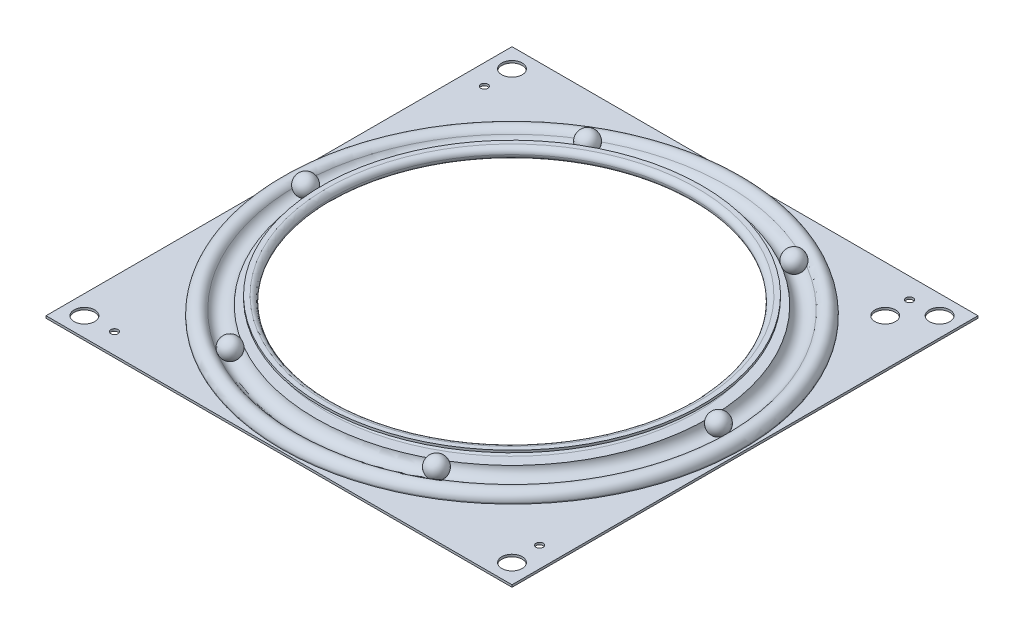
from build123d import *

# Parameters (mm, degrees)
SKETCH2_W                                 = 154.0002
SKETCH2_H                                 = 154.0002
SKETCH2_R                                 = 75.529340861
EXTRUDE1_DEPTH                            = 0.7366
EXTRUDE2_START                            = -0.7366
SKETCH3_R                                 = 75.529340861
EXTRUDE2_DEPTH                            = 0.7366
CIRPATTERN1_COUNT                         = 6
SKETCH5_W                                 = 3.3782
SKETCH5_H                                 = 0.7366
F_5_32_0_156250_DIAMETER_HOLE1_AT_2_COUNT = 2
F_5_32_0_156250_DIAMETER_HOLE1_AT_2_PITCH = 141.3002
F_5_32_0_156250_DIAMETER_HOLE1_AT_3_COUNT = 2
F_5_32_0_156250_DIAMETER_HOLE1_AT_3_PITCH = 141.3002
F_5_32_0_156250_DIAMETER_HOLE1_AT_4_COUNT = 2
F_5_32_0_156250_DIAMETER_HOLE1_AT_4_PITCH = 199.828659206
SKETCH7_W                                 = 2.3876
SKETCH7_H                                 = 8.128
F_5_32_0_156250_DIAMETER_HOLE2_AT_2_COUNT = 2
F_5_32_0_156250_DIAMETER_HOLE2_AT_2_PITCH = 121.0564
F_5_32_0_156250_DIAMETER_HOLE2_AT_3_COUNT = 2
F_5_32_0_156250_DIAMETER_HOLE2_AT_3_PITCH = 171.199602692
F_5_32_0_156250_DIAMETER_HOLE2_AT_4_COUNT = 2
F_5_32_0_156250_DIAMETER_HOLE2_AT_4_PITCH = 121.0564
CIRPATTERN2_COUNT                         = 4
SKETCH14_R                                = 3.3782
CUT_EXTRUDE2_DEPTH                        = 110.094654388


# Read off the part's stored shape, not the designer's step: Revolve-Thin5
with BuildPart() as part:
    # Sketch1 → Revolve-Thin4 (revolve)
    with BuildSketch(Plane.XY, mode=Mode.PRIVATE) as revolve_thin4_sk:
        with BuildLine():
            Line((62.74854946, 1.778), (61.214, 1.778))
            ThreePointArc((61.214, 1.778), (59.436, 0), (61.214, -1.778))
            Line((61.214, -1.778), (64.28309892, -1.778))
            ThreePointArc((64.28309892, -1.778), (67.669225582, -4.788771381), (71.737577241, -2.794))
            ThreePointArc((71.737577241, -2.794), (74.023261161, -1.847238721), (75.529340861, -3.81))
            Line((75.529340861, -3.81), (75.529340861, -4.826))
            Line((75.529340861, -4.826), (77.0001, -4.826))
            Line((77.0001, -4.826), (77.0001, -4.0894))
            Line((77.0001, -4.0894), (76.265940861, -4.0894))
            Line((76.265940861, -4.0894), (76.265940861, -3.81))
            ThreePointArc((76.265940861, -3.81), (74.21390727, -1.135737757), (71.099662929, -2.4257))
            ThreePointArc((71.099662929, -2.4257), (67.492675346, -4.00937161), (64.902401285, -1.0414))
            Line((64.902401285, -1.0414), (61.214, -1.0414))
            ThreePointArc((61.214, -1.0414), (60.1726, 0), (61.214, 1.0414))
            Line((61.214, 1.0414), (62.74854946, 1.0414))
            Line((62.74854946, 1.0414), (62.74854946, 1.778))
        make_face()
    revolve(revolve_thin4_sk.sketch.rotate(Axis((0, 21.71272626, 0), (0, -1, 0)), 90), axis=Axis((0, 21.71272626, 0), (0, -1, 0)))

    # Sketch2 → Extrude1 (add)
    with BuildSketch(Plane.XZ.offset(4.826)):
        Rectangle(SKETCH2_W, SKETCH2_H)
        with Locations(Location((0, 0, 0), (0, 0, 90))):
            Circle(SKETCH2_R, mode=Mode.SUBTRACT)
    extrude(amount=-EXTRUDE1_DEPTH)

    # Sketch5 → 5/32 (0.156250) Diameter Hole1 (revolve, cut)
    with BuildSketch(Plane(origin=(70.6501, -4.0894, -70.6501), x_dir=(0, 0, 1), z_dir=(1, 0, 0))):
        with Locations((1.6891, 0.3683)):
            Rectangle(SKETCH5_W, SKETCH5_H)
    f_5_32_0_156250_diameter_hole1 = revolve(axis=Axis((70.6501, 2.2606, -70.6501), (0, -1, 0)), mode=Mode.SUBTRACT)

    # 5/32 (0.156250) Diameter Hole1 at 2: 5/32 (0.156250) Diameter Hole1 ×2
    with Locations(*[(0, 0, i * F_5_32_0_156250_DIAMETER_HOLE1_AT_2_PITCH) for i in range(1, F_5_32_0_156250_DIAMETER_HOLE1_AT_2_COUNT)]):
        add(f_5_32_0_156250_diameter_hole1, mode=Mode.SUBTRACT)

    # 5/32 (0.156250) Diameter Hole1 at 3: 5/32 (0.156250) Diameter Hole1 ×2
    with Locations(*[(-i * F_5_32_0_156250_DIAMETER_HOLE1_AT_3_PITCH, 0, 0) for i in range(1, F_5_32_0_156250_DIAMETER_HOLE1_AT_3_COUNT)]):
        add(f_5_32_0_156250_diameter_hole1, mode=Mode.SUBTRACT)

    # 5/32 (0.156250) Diameter Hole1 at 4: 5/32 (0.156250) Diameter Hole1 ×2
    with Locations(*[Vector(-0.7071067811865476, 0, 0.7071067811865476) * (i * F_5_32_0_156250_DIAMETER_HOLE1_AT_4_PITCH) for i in range(1, F_5_32_0_156250_DIAMETER_HOLE1_AT_4_COUNT)]):
        add(f_5_32_0_156250_diameter_hole1, mode=Mode.SUBTRACT)

    # Sketch11 → 3/32 (0.093750) Diameter Hole2 (revolve, cut)
    with BuildSketch(Plane(origin=(-70.2437, -4.0894, -61.1251), x_dir=(0, 0, 1), z_dir=(1, 0, 0))):
        Polygon((0, 0), (0, 26.115399675), (1.190625, 25.4), (1.190625, 0), align=None)
    f_3_32_0_093750_diameter_hole2 = revolve(axis=Axis((-70.2437, 2.2606, -61.1251), (0, -1, 0)), mode=Mode.SUBTRACT)

    # CirPattern2: 3/32 (0.093750) Diameter Hole2 ×4 about axis
    cirpattern2_axis = Axis((0, 0, 0), (0, 1, 0))
    for i in range(1, CIRPATTERN2_COUNT):
        add(f_3_32_0_093750_diameter_hole2.rotate(cirpattern2_axis, i * 360 / CIRPATTERN2_COUNT), mode=Mode.SUBTRACT)

    # Sketch14 → Cut-Extrude2 (cut, through all)
    with BuildSketch(Plane(origin=(0, -4.0894, 0), x_dir=(1, 0, 0), z_dir=(0, 1, 0))):
        with Locations(Location((61.669843879, 61.669843879, 0), (0, 0, 270))):
            Circle(SKETCH14_R)
    extrude(amount=-CUT_EXTRUDE2_DEPTH, mode=Mode.SUBTRACT)


with BuildPart() as body_2:
    # Revolve-Thin5 outline → Revolve-Thin5 (revolve)
    with BuildSketch(Plane.XY):
        with BuildLine():
            Line((76.265940861, 2.5654), (77.0001, 2.5654))
            Line((77.0001, 2.5654), (77.0001, 3.302))
            Line((77.0001, 3.302), (75.529340861, 3.302))
            Line((75.529340861, 3.302), (75.529340861, 2.286))
            ThreePointArc((75.529340861, 2.286), (74.023261161, 0.323238721), (71.737577241, 1.27))
            ThreePointArc((71.737577241, 1.27), (68.088390068, 3.299931105), (64.576093872, 1.0414))
            Line((64.576093872, 1.0414), (61.214, 1.0414))
            Line((61.214, 1.0414), (61.214, 0.3048))
            Line((61.214, 0.3048), (65.066299927, 0.3048))
            ThreePointArc((65.066299927, 0.3048), (67.890458911, 2.54923464), (71.099662929, 0.9017))
            ThreePointArc((71.099662929, 0.9017), (74.21390727, -0.388262243), (76.265940861, 2.286))
            Line((76.265940861, 2.286), (76.265940861, 2.5654))
        make_face()
    revolve(axis=Axis((0, 0, 0), (0, 1, 0)))

    # Sketch3 → Extrude2 (add)
    with BuildSketch(Plane(origin=(0, 3.302, 0), x_dir=(-1, 0, 0), z_dir=(0, 1, 0)).offset(EXTRUDE2_START)):
        Polygon((0, -108.894585724), (108.894585724, 0), (0, 108.894585724), (-108.894585724, 0), align=None)
        with Locations(Location((0, 0, 0), (0, 0, 90))):
            Circle(SKETCH3_R, mode=Mode.SUBTRACT)
    extrude(amount=EXTRUDE2_DEPTH)

    # Sketch7 → 5/32 (0.156250) Diameter Hole2 (revolve, cut)
    with BuildSketch(Plane(origin=(85.599801346, 3.302, 0), x_dir=(0, 0, 1), z_dir=(1, 0, 0))):
        with Locations((1.1938, 4.064)):
            Rectangle(SKETCH7_W, SKETCH7_H)
    f_5_32_0_156250_diameter_hole2 = revolve(axis=Axis((85.599801346, 9.652, 0), (0, -1, 0)), mode=Mode.SUBTRACT)

    # 5/32 (0.156250) Diameter Hole2 at 2: 5/32 (0.156250) Diameter Hole2 ×2
    with Locations(*[Vector(-0.7071067811865476, 0, -0.7071067811865476) * (i * F_5_32_0_156250_DIAMETER_HOLE2_AT_2_PITCH) for i in range(1, F_5_32_0_156250_DIAMETER_HOLE2_AT_2_COUNT)]):
        add(f_5_32_0_156250_diameter_hole2, mode=Mode.SUBTRACT)

    # 5/32 (0.156250) Diameter Hole2 at 3: 5/32 (0.156250) Diameter Hole2 ×2
    with Locations(*[(-i * F_5_32_0_156250_DIAMETER_HOLE2_AT_3_PITCH, 0, 0) for i in range(1, F_5_32_0_156250_DIAMETER_HOLE2_AT_3_COUNT)]):
        add(f_5_32_0_156250_diameter_hole2, mode=Mode.SUBTRACT)

    # 5/32 (0.156250) Diameter Hole2 at 4: 5/32 (0.156250) Diameter Hole2 ×2
    with Locations(*[Vector(-0.7071067811865476, 0, 0.7071067811865476) * (i * F_5_32_0_156250_DIAMETER_HOLE2_AT_4_PITCH) for i in range(1, F_5_32_0_156250_DIAMETER_HOLE2_AT_4_COUNT)]):
        add(f_5_32_0_156250_diameter_hole2, mode=Mode.SUBTRACT)


with BuildPart() as body_3:
    # Sketch4 → Revolve1 (revolve)
    with BuildSketch(Plane.XY):
        with BuildLine():
            Line((68.21805, 2.5146), (68.21805, -4.0386))
            ThreePointArc((68.21805, -4.0386), (71.49465, -0.762), (68.21805, 2.5146))
        make_face()
    revolve(axis=Axis((68.21805, 2.837450101, 0), (0, -1, 0)))


with BuildPart() as cirpattern1_1:
    # CirPattern1: pattern copy
    add(body_3.part.rotate(Axis((0, 0, 0), (0, 1, 0)), 1 * 360 / CIRPATTERN1_COUNT))


with BuildPart() as cirpattern1_2:
    # CirPattern1: pattern copy
    add(body_3.part.rotate(Axis((0, 0, 0), (0, 1, 0)), 2 * 360 / CIRPATTERN1_COUNT))


with BuildPart() as cirpattern1_3:
    # CirPattern1: pattern copy
    add(body_3.part.rotate(Axis((0, 0, 0), (0, 1, 0)), 3 * 360 / CIRPATTERN1_COUNT))


with BuildPart() as cirpattern1_4:
    # CirPattern1: pattern copy
    add(body_3.part.rotate(Axis((0, 0, 0), (0, 1, 0)), 4 * 360 / CIRPATTERN1_COUNT))


with BuildPart() as cirpattern1_5:
    # CirPattern1: pattern copy
    add(body_3.part.rotate(Axis((0, 0, 0), (0, 1, 0)), 5 * 360 / CIRPATTERN1_COUNT))


solid = Compound([part.part, body_3.part, cirpattern1_1.part, cirpattern1_2.part, cirpattern1_3.part, cirpattern1_4.part, cirpattern1_5.part])
